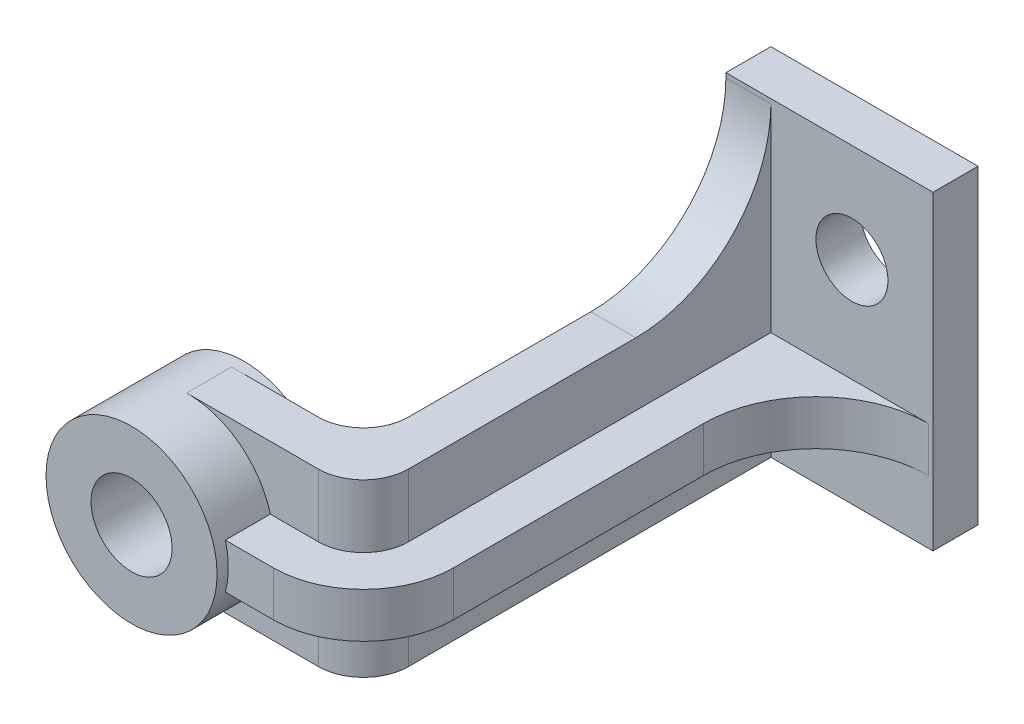
from build123d import *

# Parameters (mm, degrees)
SKETCH1_W           = 69
SKETCH1_H           = 46
BOSS_EXTRUDE1_DEPTH = 10
SKETCH2_R           = 19
SKETCH2_R_2         = 9
BOSS_EXTRUDE2_DEPTH = 25
BOSS_EXTRUDE3_DEPTH = 19
FILLET1_R           = 30
FILLET2_R           = 10
RIB1_START          = -5
RIB1_DEPTH          = 10
FILLET3_R           = 25
SKETCH7_R           = 8
CUT_EXTRUDE1_DEPTH  = 38


# Read off the part's stored shape, not the designer's step: Rib1
with BuildPart() as part:
    # Sketch1 → Boss-Extrude1 (new body)
    with BuildSketch(Plane(origin=(0, 0, 0), x_dir=(0, 1, 0), z_dir=(0, 0, 1))):
        Rectangle(SKETCH1_W, SKETCH1_H)
    extrude(amount=BOSS_EXTRUDE1_DEPTH)



with BuildPart() as body_2:
    # Sketch2 → Boss-Extrude2 (new body)
    with BuildSketch(Plane(origin=(0, 0, 113), x_dir=(-1, 0, 0), z_dir=(0, 0, -1))):
        with Locations((52, -15.5)):
            Circle(SKETCH2_R)
        with Locations((52, -15.5)):
            Circle(SKETCH2_R_2, mode=Mode.SUBTRACT)
    extrude(amount=BOSS_EXTRUDE2_DEPTH)


with BuildPart() as part_1:
    add(part.part)

    add(body_2.part)  # Boss-Extrude3 merges body 2
    # Sketch5 → Boss-Extrude3 (add, symmetric)
    with BuildSketch(Plane(origin=(0, -15.5, 0), x_dir=(-1, 0, 0), z_dir=(0, -1, 0))):
        Polygon((23, -10), (23, -90.5), (52.274133124, -90.5), (52.274133124, -100.5), (13, -100.5), (13, -10), align=None)
    extrude(amount=BOSS_EXTRUDE3_DEPTH, both=True)

    # Fillet1
    fillet1_edges = [part_1.edges().sort_by_distance(p)[0] for p in [
        (-18, 3.5, 10),
    ]]
    fillet(fillet1_edges, radius=FILLET1_R)

    # Fillet2
    fillet2_edges = [part_1.edges().sort_by_distance(p)[0] for p in [
        (-23, -15.5, 90.5),
    ]]
    fillet(fillet2_edges, radius=FILLET2_R - 0.0001)  # a hair under: the kernel refuses the full size
    fillet2_2_edges = [part_1.edges().sort_by_distance(p)[0] for p in [
        (-13, -15.5, 100.5),
    ]]
    fillet(fillet2_2_edges, radius=FILLET2_R)

    # Rib1 outline → Rib1 (add)
    with BuildSketch(Plane(origin=(0, -15.5, 0), x_dir=(-1, 0, 0), z_dir=(0, -1, 0)).offset(RIB1_START)):
        with BuildLine():
            Line((23, -110.5), (35, -110.5))
            Line((35, -110.5), (35, -100.5))
            Line((35, -100.5), (23, -100.5))
            ThreePointArc((23, -100.5), (15.928932188, -97.571067812), (13, -90.5))
            Line((13, -90.5), (13, -10))
            Line((13, -10), (3, -10))
            Line((3, -10), (3, -90.5))
            ThreePointArc((3, -90.5), (8.857864376, -104.642135624), (23, -110.5))
        make_face()
    extrude(amount=RIB1_DEPTH)

    # Fillet3
    fillet3_edges = [part_1.edges().sort_by_distance(p)[0] for p in [
        (-3, -15.5, 10),
    ]]
    fillet(fillet3_edges, radius=FILLET3_R)

    # Sketch7 → Cut-Extrude1 (cut)
    with BuildSketch(Plane.XY.offset(10)):
        with Locations((5, 12.5)):
            Circle(SKETCH7_R)
    extrude(amount=-CUT_EXTRUDE1_DEPTH, mode=Mode.SUBTRACT)


solid = part_1.part
